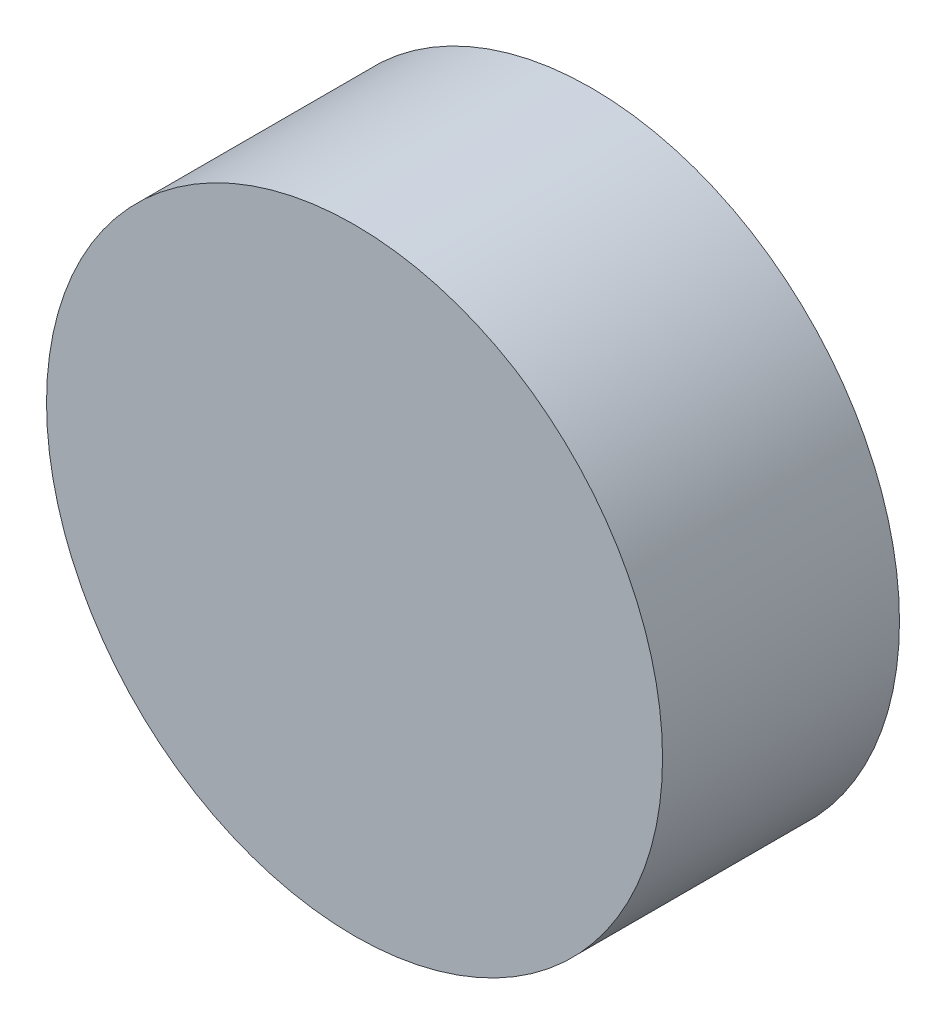
from build123d import *

# Parameters (mm, degrees)
SKETCH_1_R             = 32.5
ABOT_RIGHT_WHEEL_DEPTH = 25


with BuildPart() as part:
    # Эскиз1 → abot_right_wheel (new body)
    with BuildSketch(Plane.XY):
        Circle(SKETCH_1_R)
    extrude(amount=ABOT_RIGHT_WHEEL_DEPTH)


solid = part.part
